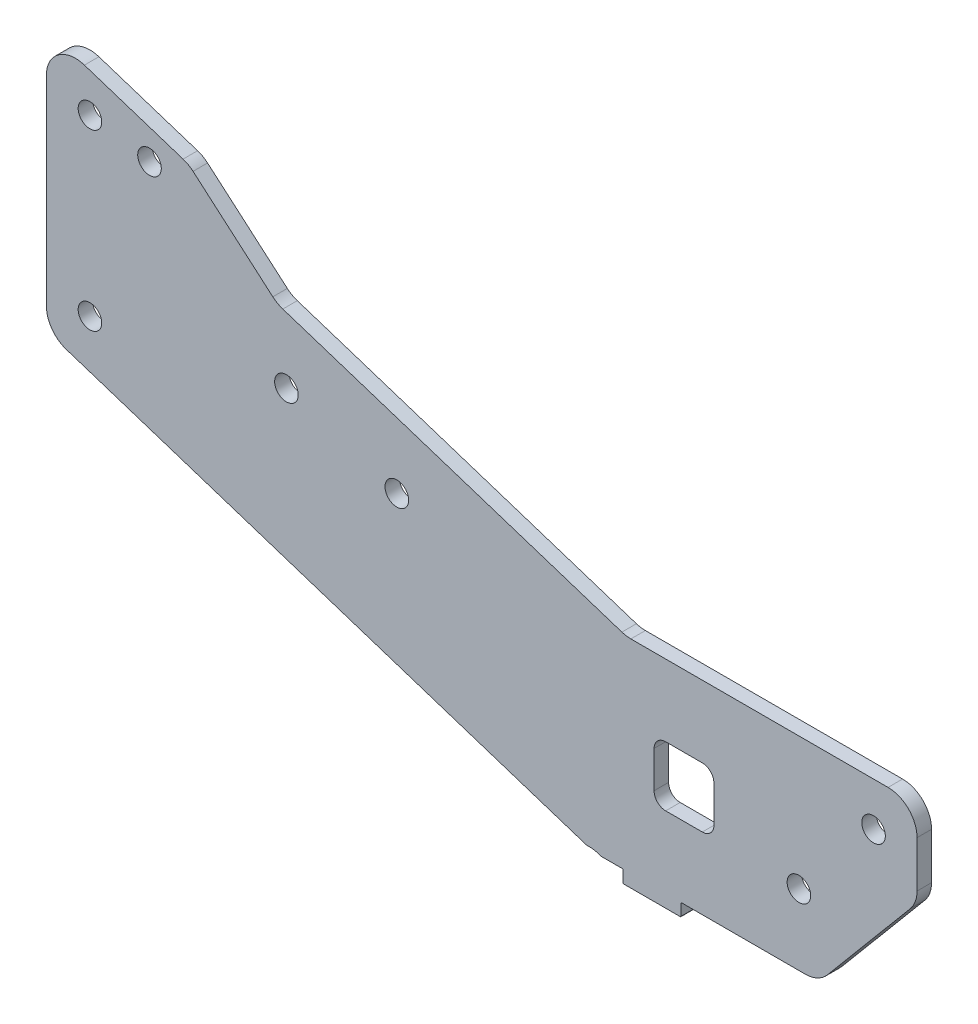
from build123d import *

# Parameters (mm, degrees)
BASE_FLANGE1_DEPTH = 6.35
SKETCH7_W          = 25.4
SKETCH7_H          = 5.55625
TAB1_DEPTH         = 6.35
SKETCH10_R         = 5.159375
CUT_EXTRUDE1_DEPTH = 397.478917898
CUT_EXTRUDE2_DEPTH = 397.478917898
SKETCH12_R         = 12.7
CUT_EXTRUDE4_DEPTH = 397.478917898
FILLET1_R          = 2.54
FILLET2_R          = 0.396875


# Sheet-metal steps are written as plain solids
with BuildPart() as part:
    # Sketch2 → Base-Flange1 (new body)
    with BuildSketch(Plane.XY):
        with BuildLine():
            Line((0, 9.226103289), (0, 96.818079958))
            ThreePointArc((0, 96.818079958), (5.235649853, 107.092975426), (16.62574439, 108.896098462))
            Line((16.62574439, 108.896098462), (59.799322894, 94.863297175))
            ThreePointArc((59.799322894, 94.863297175), (62.104900611, 93.851471549), (64.16555713, 92.40469084))
            Line((64.16555713, 92.40469084), (99.070578742, 62.316397702))
            ThreePointArc((99.070578742, 62.316397702), (101.131235261, 60.869616993), (103.436812978, 59.857791367))
            Line((103.436812978, 59.857791367), (251.828096727, 11.625852535))
            ThreePointArc((251.828096727, 11.625852535), (253.766485462, 11.160330172), (255.753841117, 11.003871039))
            Line((255.753841117, 11.003871039), (368.3, 11.003871039))
            ThreePointArc((368.3, 11.003871039), (377.280256121, 7.28412716), (381, -1.696128961))
            Line((381, -1.696128961), (381, -21.925343231))
            ThreePointArc((381, -21.925343231), (380.234096284, -26.268999051), (378.028764428, -30.088745874))
            Line((378.028764428, -30.088745874), (341.720264081, -73.359531604))
            ThreePointArc((341.720264081, -73.359531604), (337.358751578, -76.706237856), (331.991499654, -77.896128961))
            Line((331.991499654, -77.896128961), (239.656685085, -77.896128961))
            Line((239.656685085, -77.896128961), (8.77425561, -2.851915215))
            ThreePointArc((8.77425561, -2.851915215), (2.425104532, 1.761753142), (0, 9.226103289))
        make_face()
    extrude(amount=-BASE_FLANGE1_DEPTH)

    # Sketch7 → Tab1 (add)
    with BuildSketch(Plane.XY):
        with Locations((265.056685085, -80.674253961)):
            Rectangle(SKETCH7_W, SKETCH7_H)
    extrude(amount=-TAB1_DEPTH)

    # Sketch10 → Cut-Extrude1 (cut, through all)
    with BuildSketch(Plane.XY):
        with Locations((361.95, -8.046128961)):
            Circle(SKETCH10_R)
        with Locations((329.296389428, -46.961186671)):
            Circle(SKETCH10_R)
        with Locations((19.05, 91.122091624)):
            Circle(SKETCH10_R)
        with Locations((19.05, 14.922091624)):
            Circle(SKETCH10_R)
        with Locations((45.111934921, 86.526669328)):
            Circle(SKETCH10_R)
        with Locations((153.335293858, 14.922091624)):
            Circle(SKETCH10_R)
        with Locations((105.023219841, 30.625069183)):
            Circle(SKETCH10_R)
    extrude(amount=-CUT_EXTRUDE1_DEPTH, mode=Mode.SUBTRACT)

    # Sketch11 → Cut-Extrude2 (cut, through all)
    with BuildSketch(Plane.XY):
        with BuildLine():
            Line((270.98625, -20.349253961), (287.02, -20.349253961))
            ThreePointArc((287.02, -20.349253961), (290.612102448, -21.837151512), (292.1, -25.429253961))
            Line((292.1, -25.429253961), (292.1, -41.463003961))
            ThreePointArc((292.1, -41.463003961), (290.612102448, -45.055106409), (287.02, -46.543003961))
            Line((287.02, -46.543003961), (270.98625, -46.543003961))
            ThreePointArc((270.98625, -46.543003961), (267.394147552, -45.055106409), (265.90625, -41.463003961))
            Line((265.90625, -41.463003961), (265.90625, -25.429253961))
            ThreePointArc((265.90625, -25.429253961), (267.394147552, -21.837151512), (270.98625, -20.349253961))
        make_face()
    extrude(amount=-CUT_EXTRUDE2_DEPTH, mode=Mode.SUBTRACT)

    # Sketch12 → Cut-Extrude4 (cut, through all)
    with BuildSketch(Plane.XY):
        with Locations((237.551232799, -89.527827626)):
            Circle(SKETCH12_R)
    extrude(amount=-CUT_EXTRUDE4_DEPTH, mode=Mode.SUBTRACT)

    # Fillet1
    fillet1_edges = [part.edges().sort_by_distance(p)[0] for p in [
        (236.503199055, -76.871144598, -3.175),
        (242.649623344, -77.896128961, -3.175),
    ]]
    fillet(fillet1_edges, radius=FILLET1_R)

    # Fillet2
    fillet2_edges = [part.edges().sort_by_distance(p)[0] for p in [
        (252.356685085, -77.896128961, -3.175),
        (277.756685085, -77.896128961, -3.175),
        (277.756685085, -83.452378961, -3.175),
        (252.356685085, -83.452378961, -3.175),
    ]]
    fillet(fillet2_edges, radius=FILLET2_R)


solid = part.part
